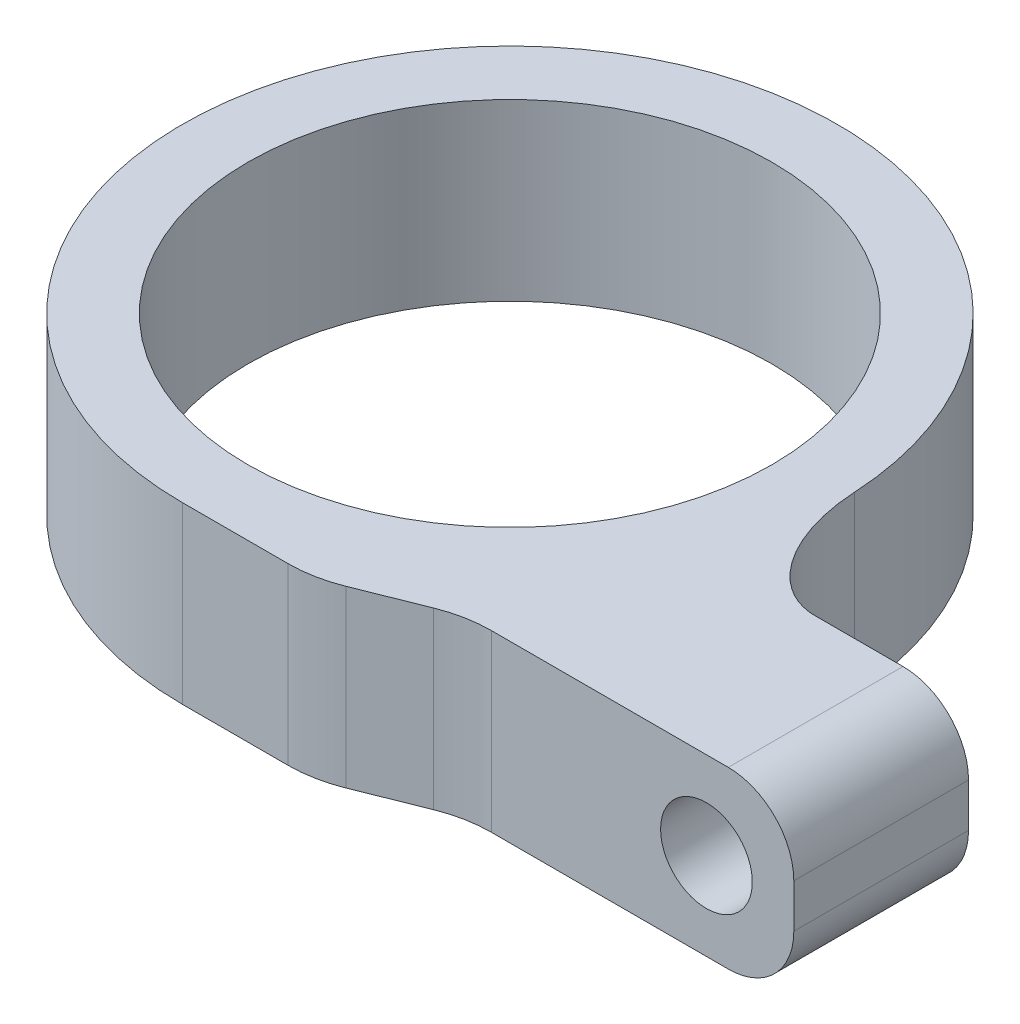
from build123d import *

# Parameters (mm, degrees)
SKETCH1_R           = 12
BOSS_EXTRUDE1_DEPTH = 8
FILLET2_R           = 6
SKETCH2_R           = 2.1
CUT_EXTRUDE1_DEPTH  = 34.763886032
FILLET3_DEPTH       = 8
FILLET4_R           = 3


with BuildPart() as part:
    # Sketch1 → Boss-Extrude1 (new body)
    with BuildSketch(Plane(origin=(0, 0, 0), x_dir=(1, 0, 0), z_dir=(0, 1, 0))):
        with BuildLine():
            Line((0, -15), (6, -15))
            Line((6, -15), (11, -13))
            Line((11, -13), (26, -13))
            Line((26, -13), (26, -5))
            Line((26, -5), (15, -5))
            Line((15, -5), (15, 0))
            ThreePointArc((15, 0), (-10.606601718, 10.606601718), (0, -15))
        make_face()
        with Locations(Location((0, 0, 0), (0, 0, 270))):
            Circle(SKETCH1_R, mode=Mode.SUBTRACT)
    extrude(amount=BOSS_EXTRUDE1_DEPTH)

    # Fillet2
    fillet2_edges = [part.edges().sort_by_distance(p)[0] for p in [
        (11, 4, 13),
        (6, 4, 15),
    ]]
    fillet(fillet2_edges, radius=FILLET2_R)

    # Sketch2 → Cut-Extrude1 (cut, through all)
    with BuildSketch(Plane(origin=(0, 0, 5), x_dir=(-1, 0, 0), z_dir=(0, 0, -1))):
        with Locations((-22, 4)):
            Circle(SKETCH2_R)
    extrude(amount=-CUT_EXTRUDE1_DEPTH, mode=Mode.SUBTRACT)

    # Fillet3: read off the stored shape, not the designer's step
    # Fillet3 outline → Fillet3 (add)
    with BuildSketch(Plane(origin=(0, 0, 0), x_dir=(1, 0, 0), z_dir=(0, 1, 0))):
        with BuildLine():
            Line((15, -5), (18.973665961, -5))
            add(Edge.make_bspline(
                [(18.973665961, -5), (15.284342024, -5), (14.979209969, 0.789473684)],
                knots=[0, 0, 0, 1, 1, 1], degree=2, weights=[1, 0.72547625, 1]))
            ThreePointArc((14.979209969, 0.789473684), (14.994801592, 0.39487369), (15, 0))
            Line((15, 0), (15, -5))
        make_face()
    extrude(amount=FILLET3_DEPTH)

    # Fillet4
    fillet4_edges = [part.edges().sort_by_distance(p)[0] for p in [
        (26, 0, 9),
        (26, 8, 9),
    ]]
    fillet(fillet4_edges, radius=FILLET4_R)


solid = part.part
